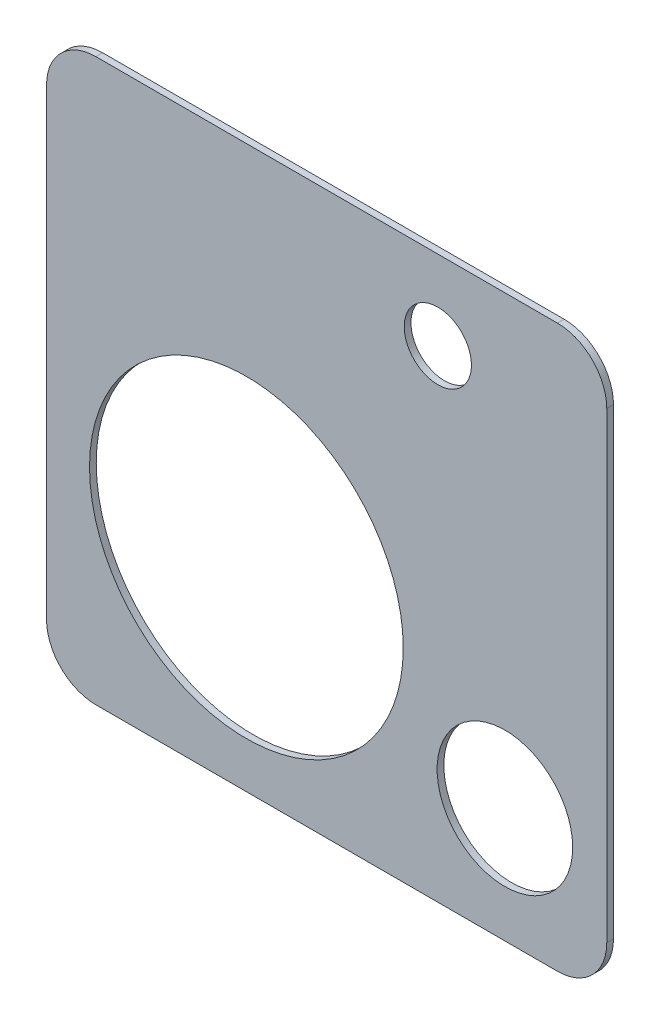
from build123d import *

# Parameters (mm, degrees)
SKETCH1_W           = 500
SKETCH1_H           = 501
BOSS_EXTRUDE1_DEPTH = 6
FILLET1_R           = 44
SKETCH3_R           = 140
CUT_EXTRUDE2_DEPTH  = 708.839671112
SKETCH5_R           = 60.5
CUT_EXTRUDE3_DEPTH  = 708.839671112
SKETCH6_R           = 30
CUT_EXTRUDE5_DEPTH  = 708.839671112


with BuildPart() as part:
    # Sketch1 → Boss-Extrude1 (new body)
    with BuildSketch(Plane.XY):
        with Locations((250, 250.5)):
            Rectangle(SKETCH1_W, SKETCH1_H)
    extrude(amount=BOSS_EXTRUDE1_DEPTH)

    # Fillet1
    fillet1_edges = [part.edges().sort_by_distance(p)[0] for p in [
        (0, 0, 3),
        (500, 0, 3),
        (0, 501, 3),
        (500, 501, 3),
    ]]
    fillet(fillet1_edges, radius=FILLET1_R)

    # Sketch3 → Cut-Extrude2 (cut, through all)
    with BuildSketch(Plane.XY.offset(6)):
        with Locations((178.369044072, 181.034738009)):
            Circle(SKETCH3_R)
    extrude(amount=-CUT_EXTRUDE2_DEPTH, mode=Mode.SUBTRACT)

    # Sketch5 → Cut-Extrude3 (cut, through all)
    with BuildSketch(Plane.XY.offset(6)):
        with Locations((409.103373264, 102.516190165)):
            Circle(SKETCH5_R)
    extrude(amount=-CUT_EXTRUDE3_DEPTH, mode=Mode.SUBTRACT)

    # Sketch6 → Cut-Extrude5 (cut, through all)
    with BuildSketch(Plane.XY.offset(6)):
        with Locations((349.228645131, 430)):
            Circle(SKETCH6_R)
    extrude(amount=-CUT_EXTRUDE5_DEPTH, mode=Mode.SUBTRACT)


solid = part.part
